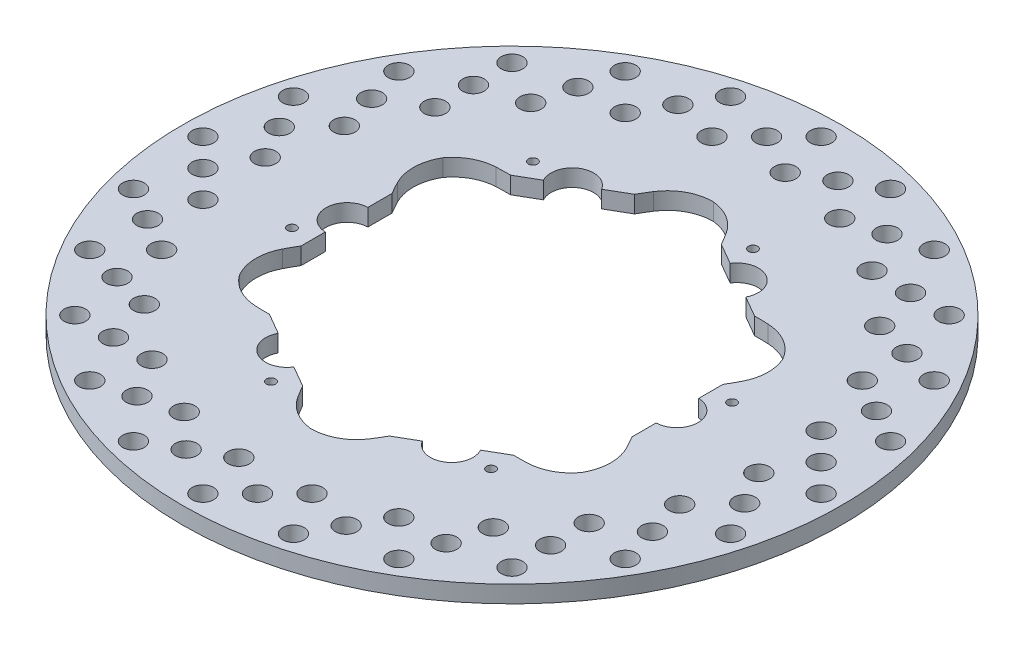
from build123d import *

# Parameters (mm, degrees)
SKETCH1_R               = 92.075
SKETCH1_R_2             = 55.5625
BOSS_EXTRUDE2_DEPTH     = 2.38125
SKETCH2_R               = 3
CUT_EXTRUDE1_DEPTH      = 131.30077765
BOSS_EXTRUDE3_DEPTH     = 2.38125
FILLET1_R               = 12.7
CIRPATTERN1_START       = -2.38125
CIRPATTERN1_DEPTH       = 4.7625
CUT_EXTRUDE3_DEPTH      = 131.300777795
CUT_EXTRUDE3_DEPTH_BACK = 131.300777795
SKETCH6_R               = 1.27


# Read off the part's stored shape, not the designer's step: CirPattern1
with BuildPart() as part:
    # Sketch1 → Boss-Extrude2 (new, symmetric)
    with BuildSketch(Plane(origin=(0, 0, 0), x_dir=(1, 0, 0), z_dir=(0, 1, 0))):
        with Locations(Location((0, 0, 0), (0, 0, 90))):
            Circle(SKETCH1_R)
        with Locations(Location((0, 0, 0), (0, 0, 90))):
            Circle(SKETCH1_R_2, mode=Mode.SUBTRACT)
    extrude(amount=BOSS_EXTRUDE2_DEPTH, both=True)

    # Sketch2 → Cut-Extrude1 (cut, through all)
    with BuildSketch(Plane.XZ.offset(2.38125)):
        with Locations(Location((0, 86.36, 0), (0, 0, 270))):
            Circle(SKETCH2_R)
        with Locations(Location((7.62, 78.74, 0), (0, 0, 270))):
            Circle(SKETCH2_R)
        with Locations(Location((15.24, 71.12, 0), (0, 0, 270))):
            Circle(SKETCH2_R)
        with Locations(Location((27.739766408, 74.084798438, 0), (0, 0, 270))):
            Circle(SKETCH2_R)
        with Locations(Location((33.12792008, 64.752242518, 0), (0, 0, 270))):
            Circle(SKETCH2_R)
        with Locations(Location((22.351612735, 83.417354358, 0), (0, 0, 270))):
            Circle(SKETCH2_R)
        with Locations(Location((45.969113577, 64.380840294, 0), (0, 0, 270))):
            Circle(SKETCH2_R)
        with Locations(Location((48.758227154, 53.971726717, 0), (0, 0, 270))):
            Circle(SKETCH2_R)
        with Locations(Location((43.18, 74.789953871, 0), (0, 0, 270))):
            Circle(SKETCH2_R)
        with Locations(Location((61.065741623, 50.289434278, 0), (0, 0, 270))):
            Circle(SKETCH2_R)
        with Locations(Location((61.065741623, 39.513126933, 0), (0, 0, 270))):
            Circle(SKETCH2_R)
        with Locations(Location((61.065741623, 61.065741623, 0), (0, 0, 270))):
            Circle(SKETCH2_R)
        with Locations(Location((72.000840294, 32.770886423, 0), (0, 0, 270))):
            Circle(SKETCH2_R)
        with Locations(Location((69.211726717, 22.361772846, 0), (0, 0, 270))):
            Circle(SKETCH2_R)
        with Locations(Location((74.789953871, 43.18, 0), (0, 0, 270))):
            Circle(SKETCH2_R)
        with Locations(Location((78.029200686, 13.019056815, 0), (0, 0, 270))):
            Circle(SKETCH2_R)
        with Locations(Location((72.641047013, 3.686500895, 0), (0, 0, 270))):
            Circle(SKETCH2_R)
        with Locations(Location((83.417354358, 22.351612735, 0), (0, 0, 270))):
            Circle(SKETCH2_R)
        with Locations(Location((78.74, -7.62, 0), (0, 0, 270))):
            Circle(SKETCH2_R)
        with Locations(Location((71.12, -15.24, 0), (0, 0, 270))):
            Circle(SKETCH2_R)
        with Locations(Location((86.36, 0, 0), (0, 0, 270))):
            Circle(SKETCH2_R)
        with Locations(Location((74.084798438, -27.739766408, 0), (0, 0, 270))):
            Circle(SKETCH2_R)
        with Locations(Location((64.752242518, -33.12792008, 0), (0, 0, 270))):
            Circle(SKETCH2_R)
        with Locations(Location((83.417354358, -22.351612735, 0), (0, 0, 270))):
            Circle(SKETCH2_R)
        with Locations(Location((64.380840294, -45.969113577, 0), (0, 0, 270))):
            Circle(SKETCH2_R)
        with Locations(Location((53.971726717, -48.758227154, 0), (0, 0, 270))):
            Circle(SKETCH2_R)
        with Locations(Location((74.789953871, -43.18, 0), (0, 0, 270))):
            Circle(SKETCH2_R)
        with Locations(Location((50.289434278, -61.065741623, 0), (0, 0, 270))):
            Circle(SKETCH2_R)
        with Locations(Location((39.513126933, -61.065741623, 0), (0, 0, 270))):
            Circle(SKETCH2_R)
        with Locations(Location((61.065741623, -61.065741623, 0), (0, 0, 270))):
            Circle(SKETCH2_R)
        with Locations(Location((32.770886423, -72.000840294, 0), (0, 0, 270))):
            Circle(SKETCH2_R)
        with Locations(Location((22.361772846, -69.211726717, 0), (0, 0, 270))):
            Circle(SKETCH2_R)
        with Locations(Location((43.18, -74.789953871, 0), (0, 0, 270))):
            Circle(SKETCH2_R)
        with Locations(Location((13.019056815, -78.029200686, 0), (0, 0, 270))):
            Circle(SKETCH2_R)
        with Locations(Location((3.686500895, -72.641047013, 0), (0, 0, 270))):
            Circle(SKETCH2_R)
        with Locations(Location((22.351612735, -83.417354358, 0), (0, 0, 270))):
            Circle(SKETCH2_R)
        with Locations(Location((-7.62, -78.74, 0), (0, 0, 270))):
            Circle(SKETCH2_R)
        with Locations(Location((-15.24, -71.12, 0), (0, 0, 270))):
            Circle(SKETCH2_R)
        with Locations(Location((0, -86.36, 0), (0, 0, 270))):
            Circle(SKETCH2_R)
        with Locations(Location((-27.739766408, -74.084798438, 0), (0, 0, 270))):
            Circle(SKETCH2_R)
        with Locations(Location((-33.12792008, -64.752242518, 0), (0, 0, 270))):
            Circle(SKETCH2_R)
        with Locations(Location((-22.351612735, -83.417354358, 0), (0, 0, 270))):
            Circle(SKETCH2_R)
        with Locations(Location((-45.969113577, -64.380840294, 0), (0, 0, 270))):
            Circle(SKETCH2_R)
        with Locations(Location((-48.758227154, -53.971726717, 0), (0, 0, 270))):
            Circle(SKETCH2_R)
        with Locations(Location((-43.18, -74.789953871, 0), (0, 0, 270))):
            Circle(SKETCH2_R)
        with Locations(Location((-61.065741623, -50.289434278, 0), (0, 0, 270))):
            Circle(SKETCH2_R)
        with Locations(Location((-61.065741623, -39.513126933, 0), (0, 0, 270))):
            Circle(SKETCH2_R)
        with Locations(Location((-61.065741623, -61.065741623, 0), (0, 0, 270))):
            Circle(SKETCH2_R)
        with Locations(Location((-72.000840294, -32.770886423, 0), (0, 0, 270))):
            Circle(SKETCH2_R)
        with Locations(Location((-69.211726717, -22.361772846, 0), (0, 0, 270))):
            Circle(SKETCH2_R)
        with Locations(Location((-74.789953871, -43.18, 0), (0, 0, 270))):
            Circle(SKETCH2_R)
        with Locations(Location((-78.029200686, -13.019056815, 0), (0, 0, 270))):
            Circle(SKETCH2_R)
        with Locations(Location((-72.641047013, -3.686500895, 0), (0, 0, 270))):
            Circle(SKETCH2_R)
        with Locations(Location((-83.417354358, -22.351612735, 0), (0, 0, 270))):
            Circle(SKETCH2_R)
        with Locations(Location((-78.74, 7.62, 0), (0, 0, 270))):
            Circle(SKETCH2_R)
        with Locations(Location((-71.12, 15.24, 0), (0, 0, 270))):
            Circle(SKETCH2_R)
        with Locations(Location((-86.36, 0, 0), (0, 0, 270))):
            Circle(SKETCH2_R)
        with Locations(Location((-74.084798438, 27.739766408, 0), (0, 0, 270))):
            Circle(SKETCH2_R)
        with Locations(Location((-64.752242518, 33.12792008, 0), (0, 0, 270))):
            Circle(SKETCH2_R)
        with Locations(Location((-83.417354358, 22.351612735, 0), (0, 0, 270))):
            Circle(SKETCH2_R)
        with Locations(Location((-64.380840294, 45.969113577, 0), (0, 0, 270))):
            Circle(SKETCH2_R)
        with Locations(Location((-53.971726717, 48.758227154, 0), (0, 0, 270))):
            Circle(SKETCH2_R)
        with Locations(Location((-74.789953871, 43.18, 0), (0, 0, 270))):
            Circle(SKETCH2_R)
        with Locations(Location((-50.289434278, 61.065741623, 0), (0, 0, 270))):
            Circle(SKETCH2_R)
        with Locations(Location((-39.513126933, 61.065741623, 0), (0, 0, 270))):
            Circle(SKETCH2_R)
        with Locations(Location((-61.065741623, 61.065741623, 0), (0, 0, 270))):
            Circle(SKETCH2_R)
        with Locations(Location((-32.770886423, 72.000840294, 0), (0, 0, 270))):
            Circle(SKETCH2_R)
        with Locations(Location((-22.361772846, 69.211726717, 0), (0, 0, 270))):
            Circle(SKETCH2_R)
        with Locations(Location((-43.18, 74.789953871, 0), (0, 0, 270))):
            Circle(SKETCH2_R)
        with Locations(Location((-13.019056815, 78.029200686, 0), (0, 0, 270))):
            Circle(SKETCH2_R)
        with Locations(Location((-3.686500895, 72.641047013, 0), (0, 0, 270))):
            Circle(SKETCH2_R)
        with Locations(Location((-22.351612735, 83.417354358, 0), (0, 0, 270))):
            Circle(SKETCH2_R)
    extrude(amount=-CUT_EXTRUDE1_DEPTH, mode=Mode.SUBTRACT)

    # Sketch3 → Boss-Extrude3 (add, symmetric)
    with BuildSketch(Plane(origin=(0, 0, 0), x_dir=(1, 0, 0), z_dir=(0, 1, 0))):
        with BuildLine():
            Line((-46.2153, 5.950469261), (-46.2153, 12.7))
            ThreePointArc((-46.2153, 12.7), (-48.74771338, 17.374444913), (-50.92387241, 22.225))
            ThreePointArc((-50.92387241, 22.225), (-55.5625, 0), (-50.92387241, -22.225))
            ThreePointArc((-50.92387241, -22.225), (-48.74771338, -17.374444913), (-46.2153, -12.7))
            Line((-46.2153, -12.7), (-46.2153, -5.950469261))
            ThreePointArc((-46.2153, -5.950469261), (-51.990625, 0), (-46.2153, 5.950469261))
        make_face()
    extrude(amount=BOSS_EXTRUDE3_DEPTH, both=True)

    # Fillet1
    fillet1_edges = [part.edges().sort_by_distance(p)[0] for p in [
        (-50.92387241, 0, -22.225),
        (-50.92387241, 0, 22.225),
    ]]
    fillet(fillet1_edges, radius=FILLET1_R)

    # CirPattern1 outline → CirPattern1 (add)
    with BuildSketch(Plane(origin=(0, 0, 0), x_dir=(1, 0, 0), z_dir=(0, 1, 0)).offset(CIRPATTERN1_START)):
        with BuildLine():
            Line((-34.106172628, 33.673623844), (-28.260907544, 37.048389213))
            ThreePointArc((-28.260907544, 37.048389213), (-25.9953125, 45.025202009), (-17.954392456, 42.998858474))
            Line((-17.954392456, 42.998858474), (-12.109127372, 46.373623844))
            ThreePointArc((-12.109127372, 46.373623844), (-11.13754759, 48.043676571), (-10.120960404, 49.68672066))
            ThreePointArc((-10.120960404, 49.68672066), (-5.442554633, 54.035768488), (0.761209038, 55.557285454))
            ThreePointArc((0.761209038, 55.557285454), (-27.119416363, 48.494625087), (-47.73341605, 28.437869091))
            ThreePointArc((-47.73341605, 28.437869091), (-43.491476124, 32.114561986), (-38.078961632, 33.603458174))
            ThreePointArc((-38.078961632, 33.603458174), (-36.093057237, 33.666290929), (-34.106172628, 33.673623844))
        make_face()
        with BuildLine():
            ThreePointArc((-47.73341605, -28.437869091), (-27.78125, -48.118536498), (-0.761209038, -55.557285454))
            ThreePointArc((-0.761209038, -55.557285454), (-6.06628845, -53.722004164), (-10.061967618, -49.77907721))
            ThreePointArc((-10.061967618, -49.77907721), (-11.109334577, -48.090649932), (-12.109127372, -46.373623844))
            Line((-12.109127372, -46.373623844), (-17.954392456, -42.998858474))
            ThreePointArc((-17.954392456, -42.998858474), (-25.9953125, -45.025202009), (-28.260907544, -37.048389213))
            Line((-28.260907544, -37.048389213), (-34.106172628, -33.673623844))
            ThreePointArc((-34.106172628, -33.673623844), (-36.093057237, -33.666290929), (-38.078961632, -33.603458174))
            ThreePointArc((-38.078961632, -33.603458174), (-43.491476124, -32.114561986), (-47.73341605, -28.437869091))
        make_face()
        with BuildLine():
            ThreePointArc((-0.761209038, -55.557285454), (27.119416363, -48.494625088), (47.73341605, -28.437869091))
            ThreePointArc((47.73341605, -28.437869091), (43.491476124, -32.114561986), (38.078961632, -33.603458174))
            ThreePointArc((38.078961632, -33.603458174), (36.093057237, -33.666290929), (34.106172628, -33.673623844))
            Line((34.106172628, -33.673623844), (28.260907544, -37.048389213))
            ThreePointArc((28.260907544, -37.048389213), (25.9953125, -45.025202009), (17.954392456, -42.998858474))
            Line((17.954392456, -42.998858474), (12.109127372, -46.373623844))
            ThreePointArc((12.109127372, -46.373623844), (11.13754759, -48.043676571), (10.120960404, -49.68672066))
            ThreePointArc((10.120960404, -49.68672066), (5.442554633, -54.035768488), (-0.761209038, -55.557285454))
        make_face()
        with BuildLine():
            ThreePointArc((47.73341605, -28.437869091), (55.557285454, -0.761209038), (48.494625088, 27.119416363))
            ThreePointArc((48.494625088, 27.119416363), (49.557764573, 21.607442178), (48.140929249, 16.175619036))
            ThreePointArc((48.140929249, 16.175619036), (47.202391814, 14.424359003), (46.2153, 12.7))
            Line((46.2153, 12.7), (46.2153, 5.950469261))
            ThreePointArc((46.2153, 5.950469261), (51.990625, 0), (46.2153, -5.950469261))
            Line((46.2153, -5.950469261), (46.2153, -12.7))
            ThreePointArc((46.2153, -12.7), (47.175818197, -14.376439137), (48.090442525, -16.07835151))
            ThreePointArc((48.090442525, -16.07835151), (49.51762554, -22.30449367), (47.73341605, -28.437869091))
        make_face()
        with BuildLine():
            ThreePointArc((48.494625088, 27.119416363), (28.437869092, 47.73341605), (0.761209038, 55.557285454))
            ThreePointArc((0.761209038, 55.557285454), (6.06628845, 53.722004164), (10.061967618, 49.77907721))
            ThreePointArc((10.061967618, 49.77907721), (11.109334577, 48.090649932), (12.109127372, 46.373623844))
            Line((12.109127372, 46.373623844), (17.954392456, 42.998858474))
            ThreePointArc((17.954392456, 42.998858474), (25.9953125, 45.025202009), (28.260907544, 37.048389213))
            Line((28.260907544, 37.048389213), (34.106172628, 33.673623844))
            ThreePointArc((34.106172628, 33.673623844), (36.038270607, 33.667237435), (37.969482121, 33.60836915))
            ThreePointArc((37.969482121, 33.60836915), (44.075070907, 31.731274817), (48.494625088, 27.119416363))
        make_face()
    extrude(amount=CIRPATTERN1_DEPTH)

    # Sketch6 → Cut-Extrude3 (cut, two sides: drawn at the far end of the back side and taken through both)
    with BuildSketch(Plane(origin=(0, 2.38125, 0), x_dir=(1, 0, 0), z_dir=(0, 1, 0)).offset(-CUT_EXTRUDE3_DEPTH_BACK)):
        with Locations(Location((-17.609679143, -49.728199843, 0), (0, 0, 270))):
            Circle(SKETCH6_R)
        with Locations(Location((-51.87072392, -9.613670431, 0), (0, 0, 270))):
            Circle(SKETCH6_R)
        with Locations(Location((-34.261044777, 40.114529412, 0), (0, 0, 270))):
            Circle(SKETCH6_R)
        with Locations(Location((17.609679143, 49.728199843, 0), (0, 0, 270))):
            Circle(SKETCH6_R)
        with Locations(Location((51.87072392, 9.613670431, 0), (0, 0, 270))):
            Circle(SKETCH6_R)
        with Locations(Location((34.261044777, -40.114529412, 0), (0, 0, 270))):
            Circle(SKETCH6_R)
    extrude(amount=CUT_EXTRUDE3_DEPTH + CUT_EXTRUDE3_DEPTH_BACK, mode=Mode.SUBTRACT)


solid = part.part
